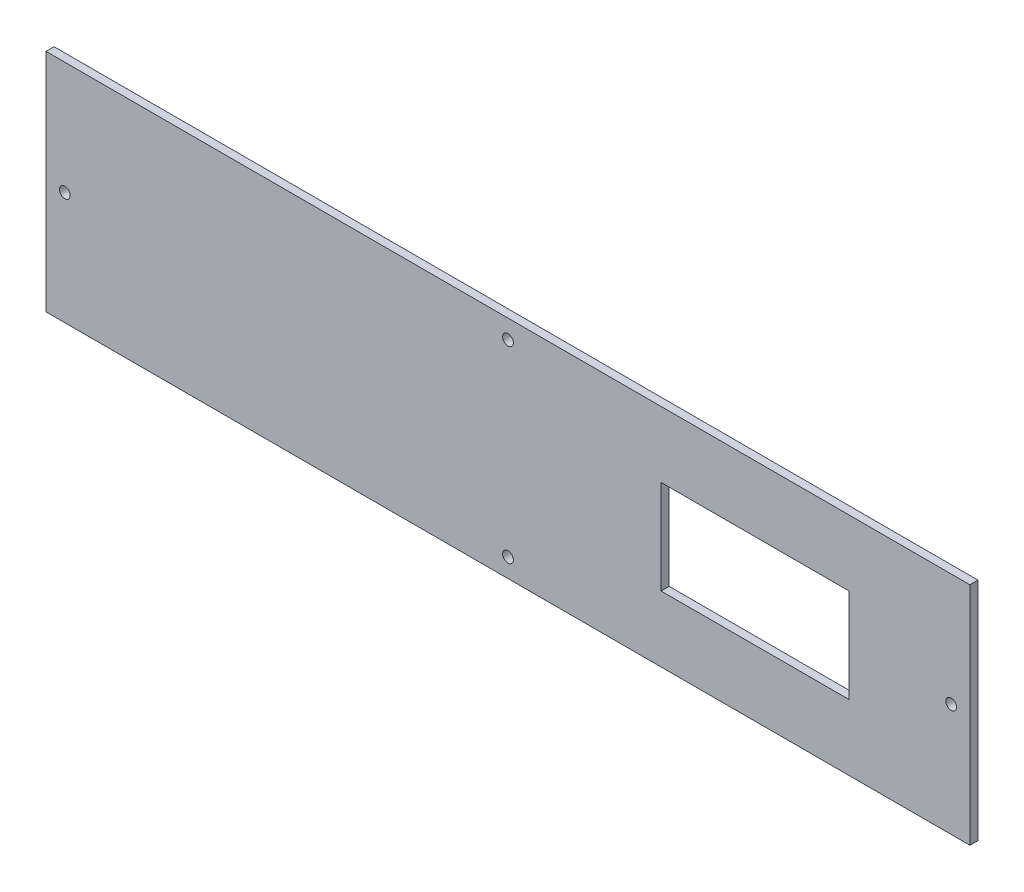
from build123d import *

# Parameters (mm, degrees)
SCHIZZO1_W                   = 344
SCHIZZO1_H                   = 84
SCHIZZO1_R                   = 2
SCHIZZO1_W_2                 = 70
SCHIZZO1_H_2                 = 35
ESTRUSIONE_ESTRUSIONE1_DEPTH = 3


with BuildPart() as part:
    # Schizzo1 → Estrusione-Estrusione1 (new body)
    with BuildSketch(Plane.XY):
        with Locations((172, 42)):
            Rectangle(SCHIZZO1_W, SCHIZZO1_H)
        with Locations((7, 42)):
            Circle(SCHIZZO1_R, mode=Mode.SUBTRACT)
        with Locations((172, 77)):
            Circle(SCHIZZO1_R, mode=Mode.SUBTRACT)
        with Locations((172, 7)):
            Circle(SCHIZZO1_R, mode=Mode.SUBTRACT)
        with Locations((337, 42)):
            Circle(SCHIZZO1_R, mode=Mode.SUBTRACT)
        with Locations((264, 42)):
            Rectangle(SCHIZZO1_W_2, SCHIZZO1_H_2, mode=Mode.SUBTRACT)
    extrude(amount=ESTRUSIONE_ESTRUSIONE1_DEPTH)


solid = part.part
